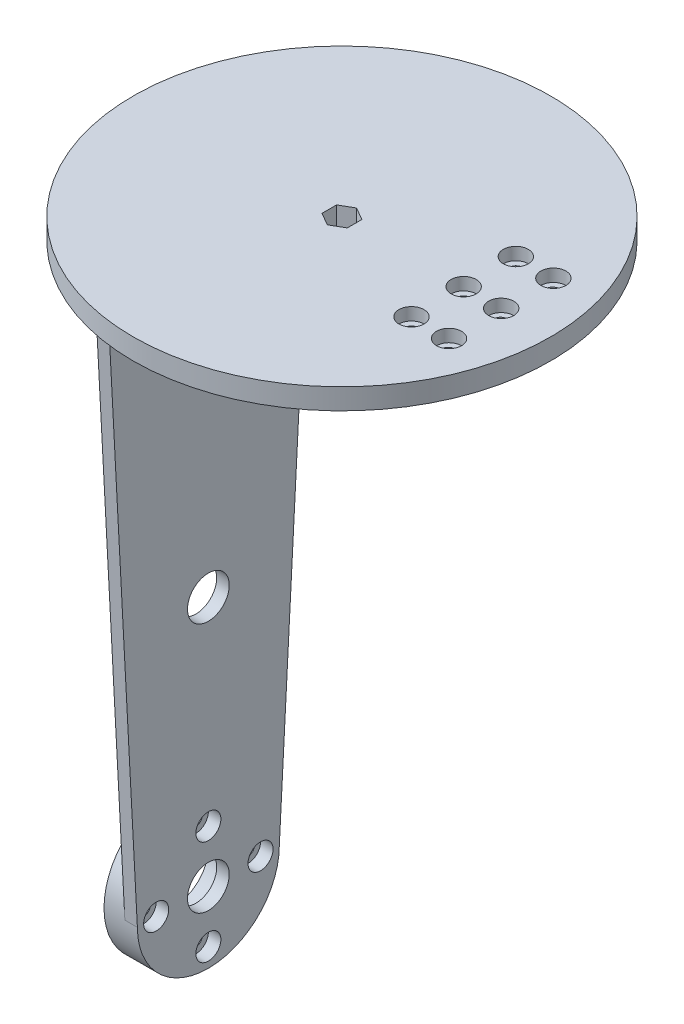
from build123d import *

# Parameters (mm, degrees)
SKETCH2_R               = 7.5
BOSS_EXTRUDE1_DEPTH     = 20
CUT_EXTRUDE1_DEPTH      = 20
SKETCH4_R               = 50
SKETCH4_R_2             = 3.995473389
BOSS_EXTRUDE3_DEPTH     = 5
CUT_EXTRUDE2_DEPTH      = 7.5
CUT_EXTRUDE2_DEPTH_BACK = 7.5
SKETCH11_R              = 1.55
CUT_EXTRUDE9_DEPTH      = 7.5
CUT_EXTRUDE9_DEPTH_BACK = 7.5
SKETCH15_R              = 1.55
SKETCH28_R              = 5
BOSS_EXTRUDE10_DEPTH    = 3
SKETCH25_R              = 17
SKETCH25_R_2            = 8
BOSS_EXTRUDE8_DEPTH     = 5
SKETCH26_R              = 1.55
CUT_EXTRUDE14_DEPTH     = 8
SKETCH27_R              = 3
CUT_EXTRUDE15_DEPTH     = 3
SKETCH16_R              = 1.55
CUT_EXTRUDE17_DEPTH     = 5
SKETCH29_R              = 3
CUT_EXTRUDE18_DEPTH     = 3


with BuildPart() as part:
    # Sketch2 → Boss-Extrude1 (new body)
    with BuildSketch(Plane(origin=(0, 0, 0), x_dir=(1, 0, 0), z_dir=(0, 1, 0))):
        Circle(SKETCH2_R)
    extrude(amount=BOSS_EXTRUDE1_DEPTH)

    # Sketch3 → Cut-Extrude1 (cut)
    with BuildSketch(Plane(origin=(0, 20, 0), x_dir=(1, 0, 0), z_dir=(0, 1, 0))):
        Polygon((0, 3.5), (-3.031088913, 1.75), (-3.031088913, -1.75), (0, -3.5), (3.031088913, -1.75), (3.031088913, 1.75), align=None)
    extrude(amount=-CUT_EXTRUDE1_DEPTH, mode=Mode.SUBTRACT)

    # Sketch4 → Boss-Extrude3 (add)
    with BuildSketch(Plane(origin=(0, 20, 0), x_dir=(1, 0, 0), z_dir=(0, 1, 0))):
        Circle(SKETCH4_R)
        Circle(SKETCH4_R_2, mode=Mode.SUBTRACT)
    extrude(amount=-BOSS_EXTRUDE3_DEPTH)

    # Sketch11 → Cut-Extrude2 (cut, two sides: drawn at the far end of the back side and taken through both)
    with BuildSketch(Plane(origin=(0, 0, 0), x_dir=(0.8660254037844348, 0, -0.5000000000000067), z_dir=(0.5000000000000067, 0, 0.8660254037844348)).offset(-CUT_EXTRUDE2_DEPTH_BACK)):
        with Locations((0, 3)):
            Circle(SKETCH11_R)
    extrude(amount=CUT_EXTRUDE2_DEPTH + CUT_EXTRUDE2_DEPTH_BACK, mode=Mode.SUBTRACT)

    # Sketch15 → Cut-Extrude9 (cut, two sides: drawn at the far end of the back side and taken through both)
    with BuildSketch(Plane(origin=(0, 0, 0), x_dir=(0, 0, -1), z_dir=(1, 0, 0)).offset(-CUT_EXTRUDE9_DEPTH_BACK)):
        with Locations((0, 9)):
            Circle(SKETCH15_R)
    extrude(amount=CUT_EXTRUDE9_DEPTH + CUT_EXTRUDE9_DEPTH_BACK, mode=Mode.SUBTRACT)

    # Sketch28 → Boss-Extrude10 (add)
    with BuildSketch(Plane.ZY.offset(32)):
        with BuildLine():
            Line((25, 15), (-25, 15))
            Line((-25, 15), (-17, -135))
            ThreePointArc((-17, -135), (0, -152), (17, -135))
            Line((17, -135), (25, 15))
        make_face()
        with Locations((0, -135)):
            Circle(SKETCH28_R, mode=Mode.SUBTRACT)
        with Locations((0, -75)):
            Circle(SKETCH28_R, mode=Mode.SUBTRACT)
    extrude(amount=BOSS_EXTRUDE10_DEPTH)

    # Sketch25 → Boss-Extrude8 (add)
    with BuildSketch(Plane.ZY.offset(35)):
        with Locations((0, -135)):
            Circle(SKETCH25_R)
        with Locations((0, -135)):
            Circle(SKETCH25_R_2, mode=Mode.SUBTRACT)
    extrude(amount=BOSS_EXTRUDE8_DEPTH)

    # Sketch26 → Cut-Extrude14 (cut)
    with BuildSketch(Plane.ZY.offset(40)):
        with Locations((-12.5, -135)):
            Circle(SKETCH26_R)
        with Locations((0, -122.5)):
            Circle(SKETCH26_R)
        with Locations((12.5, -135)):
            Circle(SKETCH26_R)
        with Locations((0, -147.5)):
            Circle(SKETCH26_R)
    extrude(amount=-CUT_EXTRUDE14_DEPTH, mode=Mode.SUBTRACT)

    # Sketch27 → Cut-Extrude15 (cut)
    with BuildSketch(Plane(origin=(-32, 0, 0), x_dir=(0, 0, -1), z_dir=(1, 0, 0))):
        with Locations((-12.5, -135)):
            Circle(SKETCH27_R)
        with Locations((0, -122.5)):
            Circle(SKETCH27_R)
        with Locations((12.5, -135)):
            Circle(SKETCH27_R)
        with Locations((0, -147.5)):
            Circle(SKETCH27_R)
    extrude(amount=-CUT_EXTRUDE15_DEPTH, mode=Mode.SUBTRACT)

    # Sketch16 → Cut-Extrude17 (cut)
    with BuildSketch(Plane.XZ.offset(-15)):
        with Locations((29.154127235, 12.5)):
            Circle(SKETCH16_R)
        with Locations((29.154127235, 0)):
            Circle(SKETCH16_R)
        with Locations((29.154127235, -12.5)):
            Circle(SKETCH16_R)
        with Locations((38, -12.5)):
            Circle(SKETCH16_R)
        with Locations((38, 0)):
            Circle(SKETCH16_R)
        with Locations((38, 12.5)):
            Circle(SKETCH16_R)
    extrude(amount=-CUT_EXTRUDE17_DEPTH, mode=Mode.SUBTRACT)

    # Sketch29 → Cut-Extrude18 (cut)
    with BuildSketch(Plane(origin=(0, 20, 0), x_dir=(1, 0, 0), z_dir=(0, 1, 0))):
        with Locations((29.154127235, 12.5)):
            Circle(SKETCH29_R)
        with Locations((38.154127235, 12.5)):
            Circle(SKETCH29_R)
        with Locations((38.154127235, 0)):
            Circle(SKETCH29_R)
        with Locations((38.154127235, -12.5)):
            Circle(SKETCH29_R)
        with Locations((29.154127235, 0)):
            Circle(SKETCH29_R)
        with Locations((29.154127235, -12.5)):
            Circle(SKETCH29_R)
    extrude(amount=-CUT_EXTRUDE18_DEPTH, mode=Mode.SUBTRACT)


solid = part.part
